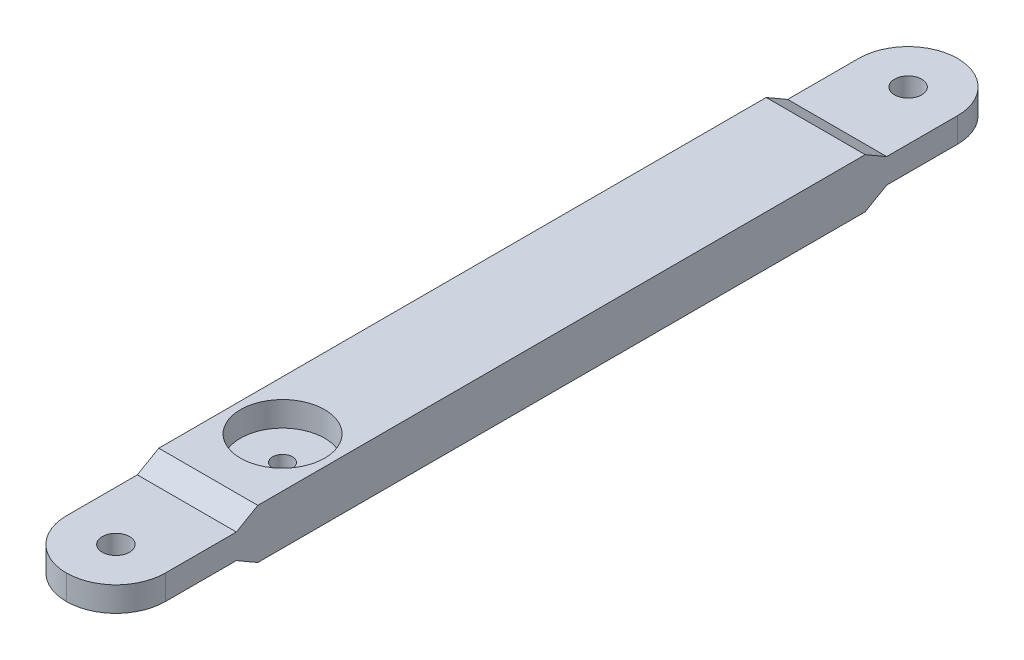
from build123d import *

# Parameters (mm, degrees)
BOSS_EXTRUDE1_DEPTH      = 70
BOSS_EXTRUDE1_DEPTH_BACK = 70
SKETCH1_W                = 20
SKETCH1_H                = 10
SKETCH3_W                = 20
SKETCH3_H                = 5
BOSS_EXTRUDE2_DEPTH      = 20
FILLET1_R                = 10
SKETCH4_R                = 2.75
CUT_EXTRUDE1_DEPTH       = 91.863909227
FILLET1_OF_MIRROR1_R     = 10
CHAMFER1_SIZE            = 8.660254038
CHAMFER1_SIZE_2          = 5
SKETCH5_R                = 8.5
CUT_EXTRUDE2_DEPTH       = 5
CUT_EXTRUDE3_DEPTH       = 91.691785736
CUT_EXTRUDE3_DEPTH_BACK  = 91.691785736
SKETCH6_R                = 2


# Some blends are built 0.0001 mm under size
with BuildPart() as part:
    # Sketch1 → Boss-Extrude1 (new, two sides: drawn at the far end of the back side and taken through both)
    with BuildSketch(Plane.XY.offset(-BOSS_EXTRUDE1_DEPTH_BACK)):
        Rectangle(SKETCH1_W, SKETCH1_H)
    extrude(amount=BOSS_EXTRUDE1_DEPTH + BOSS_EXTRUDE1_DEPTH_BACK)

    # Sketch3 → Boss-Extrude2 (add)
    with BuildSketch(Plane(origin=(0, 0, -70), x_dir=(-1, 0, 0), z_dir=(0, 0, -1))):
        Rectangle(SKETCH3_W, SKETCH3_H)
    boss_extrude2 = extrude(amount=BOSS_EXTRUDE2_DEPTH)

    # Fillet1
    fillet1_edges = [part.edges().sort_by_distance(p)[0] for p in [
        (-10, 0, -90),
        (10, 0, -90),
    ]]
    fillet(fillet1_edges, radius=FILLET1_R - 0.0001)  # a hair under: the kernel refuses the full size

    # Sketch4 → Cut-Extrude1 (cut, through all)
    with BuildSketch(Plane(origin=(0, 2.5, 0), x_dir=(1, 0, 0), z_dir=(0, 1, 0))):
        with Locations(Location((0, 80, 0), (0, 0, 270))):
            Circle(SKETCH4_R)
    cut_extrude1 = extrude(amount=-CUT_EXTRUDE1_DEPTH, mode=Mode.SUBTRACT)

    # Mirror1: Boss-Extrude2, Cut-Extrude1 across plane
    add(boss_extrude2.mirror(Plane.XY))
    add(cut_extrude1.mirror(Plane.XY), mode=Mode.SUBTRACT)

    # Fillet1 of Mirror1
    fillet1_of_mirror1_edges = [part.edges().sort_by_distance(p)[0] for p in [
        (-10, 0, 90),
        (10, 0, 90),
    ]]
    fillet(fillet1_of_mirror1_edges, radius=FILLET1_OF_MIRROR1_R - 0.0001)  # a hair under: the kernel refuses the full size

    # Chamfer1
    # the kernel refuses this chamfer: 8.660254038, 5 mm, written as the material it takes off along each edge
    with BuildSketch(Plane(origin=(32.404819853, 5, -70), x_dir=(0, 0.019326765612700594, 0.999813220622208), z_dir=(-1, 0, 0))) as chamfer1_piece_1_section:
        Polygon((CHAMFER1_SIZE * 0.999813220604, -CHAMFER1_SIZE * 0.0193267656124), (-CHAMFER1_SIZE_2 * 0.0193267656127, -CHAMFER1_SIZE_2 * 0.999813220622), (0, 0), align=None)
    chamfer1_piece_1 = extrude(amount=64.809639706, mode=Mode.PRIVATE)
    chamfer1_piece_1 = split(chamfer1_piece_1, bisect_by=Plane(origin=(0, 2.5, -66.539331058), z_dir=(0, 1, 0)), keep=Keep.TOP, mode=Mode.PRIVATE)
    add(chamfer1_piece_1, mode=Mode.SUBTRACT)
    with BuildSketch(Plane(origin=(-32.404819853, -5, -70), x_dir=(0, -0.019326765612700594, 0.999813220622208), z_dir=(1, 0, 0))) as chamfer1_piece_2_section:
        Polygon((CHAMFER1_SIZE * 0.999813220604, -CHAMFER1_SIZE * 0.0193267656124), (-CHAMFER1_SIZE_2 * 0.0193267656127, -CHAMFER1_SIZE_2 * 0.999813220622), (0, 0), align=None)
    chamfer1_piece_2 = extrude(amount=64.809639706, mode=Mode.PRIVATE)
    chamfer1_piece_2 = split(chamfer1_piece_2, bisect_by=Plane(origin=(0, -2.5, -66.539331058), z_dir=(0, -1, 0)), keep=Keep.TOP, mode=Mode.PRIVATE)
    add(chamfer1_piece_2, mode=Mode.SUBTRACT)
    with BuildSketch(Plane(origin=(-32.404819853, -5, 70), x_dir=(0, 0.9983227437537926, 0.05789386240267045), z_dir=(1, 0, 0))) as chamfer1_piece_3_section:
        Polygon((CHAMFER1_SIZE_2 * 0.998322743754, -CHAMFER1_SIZE_2 * 0.0578938624027), (-CHAMFER1_SIZE * 0.0578938624016, -CHAMFER1_SIZE * 0.998322743736), (0, 0), align=None)
    chamfer1_piece_3 = extrude(amount=64.809639706, mode=Mode.PRIVATE)
    chamfer1_piece_3 = split(chamfer1_piece_3, bisect_by=Plane(origin=(0, -2.5, 66.539331058), z_dir=(0, -1, 0)), keep=Keep.TOP, mode=Mode.PRIVATE)
    add(chamfer1_piece_3, mode=Mode.SUBTRACT)
    with BuildSketch(Plane(origin=(32.404819853, 5, 70), x_dir=(0, -0.9983227437537926, 0.05789386240267045), z_dir=(-1, 0, 0))) as chamfer1_piece_4_section:
        Polygon((CHAMFER1_SIZE_2 * 0.998322743754, -CHAMFER1_SIZE_2 * 0.0578938624027), (-CHAMFER1_SIZE * 0.0578938624016, -CHAMFER1_SIZE * 0.998322743736), (0, 0), align=None)
    chamfer1_piece_4 = extrude(amount=64.809639706, mode=Mode.PRIVATE)
    chamfer1_piece_4 = split(chamfer1_piece_4, bisect_by=Plane(origin=(0, 2.5, 66.539331058), z_dir=(0, 1, 0)), keep=Keep.TOP, mode=Mode.PRIVATE)
    add(chamfer1_piece_4, mode=Mode.SUBTRACT)

    # Sketch5 → Cut-Extrude2 (cut)
    with BuildSketch(Plane(origin=(0, 5, 0), x_dir=(1, 0, 0), z_dir=(0, 1, 0))):
        with Locations(Location((0, -46.339745962, 0), (0, 0, 270))):
            Circle(SKETCH5_R)
    extrude(amount=-CUT_EXTRUDE2_DEPTH, mode=Mode.SUBTRACT)

    # Sketch6 → Cut-Extrude3 (cut, two sides: drawn at the far end of the back side and taken through both)
    with BuildSketch(Plane(origin=(0, 0, 0), x_dir=(1, 0, 0), z_dir=(0, 1, 0)).offset(-CUT_EXTRUDE3_DEPTH_BACK)):
        with Locations(Location((0, -46.339745962, 0), (0, 0, 270))):
            Circle(SKETCH6_R)
    extrude(amount=CUT_EXTRUDE3_DEPTH + CUT_EXTRUDE3_DEPTH_BACK, mode=Mode.SUBTRACT)


solid = part.part
